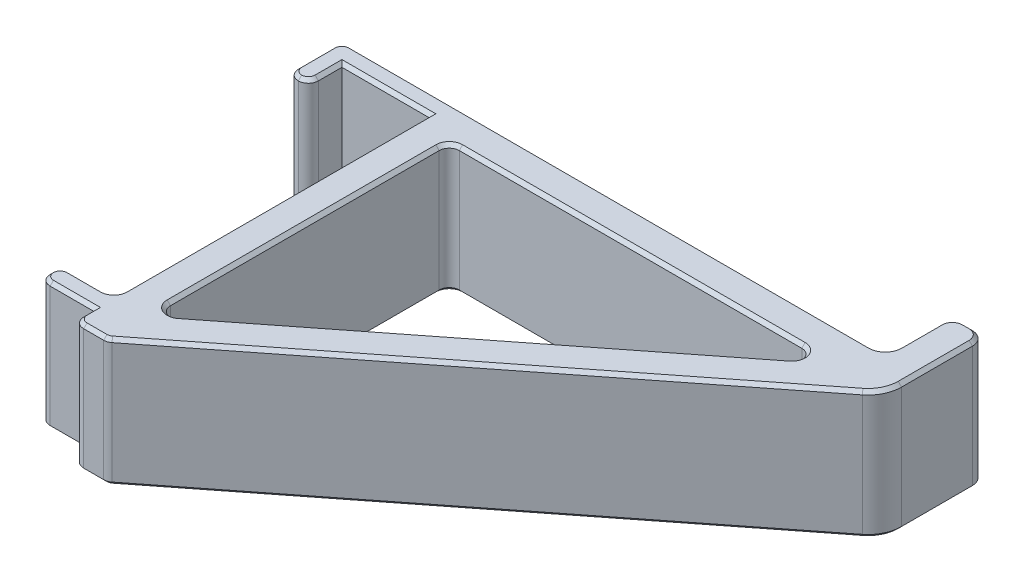
from build123d import *

# Parameters (mm, degrees)
BOSS_EXTRUDE1_DEPTH = 19
FILLET1_R           = 1.5
FILLET2_R           = 2
FILLET3_R           = 5
CHAMFER1_SIZE       = 0.5


with BuildPart() as part:
    # Sketch1 → Boss-Extrude1 (new body)
    with BuildSketch(Plane(origin=(0, 0, 0), x_dir=(1, 0, 0), z_dir=(0, 1, 0))):
        Polygon((-47.925925926, 24.470420803), (-47.925925926, -7.529579197), (-47.925925926, -22.529579197), (-55.925925926, -22.529579197), (-55.925925926, -25.529579197), (-47.925925926, -25.529579197), (-47.925925926, -28.529579197), (-42.925925926, -28.529579197), (22.074074074, 22.470420803), (22.074074074, 24.470420803), (22.074074074, 27.470420803), (22.074074074, 37.470420803), (17.074074074, 37.470420803), (17.074074074, 27.470420803), (-42.925925926, 27.470420803), (-47.925925926, 27.470420803), (-63.925925926, 27.470420803), (-63.925925926, 24.470420803), (-63.925925926, 19.470420803), (-60.925925926, 19.470420803), (-60.925925926, 24.470420803), align=None)
        Polygon((13.974112284, 22.470420803), (-13.512360238, 0.904111593), (-42.925925926, -22.174224561), (-42.925925926, 22.470420803), align=None, mode=Mode.SUBTRACT)
    extrude(amount=BOSS_EXTRUDE1_DEPTH)

    # Fillet1
    fillet1_edges = [part.edges().sort_by_distance(p)[0] for p in [
        (13.974112284, 9.5, -22.470420803),
        (-42.925925926, 9.5, -22.470420803),
        (-42.925925926, 9.5, 22.174224561),
        (-47.925925926, 9.5, 28.529579197),
        (-55.925925926, 9.5, 25.529579197),
        (-55.925925926, 9.5, 22.529579197),
        (-47.925925926, 9.5, 22.529579197),
        (-63.925925926, 9.5, -27.470420803),
        (-63.925925926, 9.5, -19.470420803),
        (-60.925925926, 9.5, -19.470420803),
        (-42.925925926, 9.5, 28.529579197),
    ]]
    fillet(fillet1_edges, radius=FILLET1_R - 0.0001)  # a hair under: the kernel refuses the full size

    # Fillet2
    fillet2_edges = [part.edges().sort_by_distance(p)[0] for p in [
        (17.074074074, 9.5, -37.470420803),
        (22.074074074, 9.5, -37.470420803),
        (17.074074074, 9.5, -27.470420803),
    ]]
    fillet(fillet2_edges, radius=FILLET2_R)

    # Fillet3
    fillet3_edges = [part.edges().sort_by_distance(p)[0] for p in [
        (22.074074074, 9.5, -22.470420803),
    ]]
    fillet(fillet3_edges, radius=FILLET3_R)

    # Chamfer1
    chamfer1_edges = [part.edges().sort_by_distance(p)[0] for p in [
        (19.574074074, 0, -37.470420803),
        (19.574074074, 19, -37.470420803),
        (17.074074074, 0, -32.470420803),
        (17.659860512, 0, -36.884634365),
        (21.488287636, 0, -36.884634365),
        (17.074074074, 19, -32.470420803),
        (17.659860512, 19, -36.884634365),
        (21.488287636, 19, -36.884634365),
        (16.488287636, 0, -28.056207241),
        (16.488287636, 19, -28.056207241),
        (22.074074074, 0, -30.186559659),
        (22.074074074, 19, -30.186559659),
        (-11.178869129, 0, 3.620350018),
        (21.570304248, 0, -22.715482427),
        (-11.178869129, 19, 3.620350018),
        (21.570304248, 19, -22.715482427),
        (-47.925925926, 0, 26.279629197),
        (-54.425925926, 0, -24.470420803),
        (-60.925925926, 0, -22.720370803),
        (-60.925925926, 19, -22.720370803),
        (-54.425925926, 19, -24.470420803),
        (-44.935070567, 0, 28.529579197),
        (-47.925925926, 19, 26.279629197),
        (-51.175975926, 0, 25.529579197),
        (-51.925925926, 0, 22.529579197),
        (-47.925925926, 0, -1.720370803),
        (-63.925925926, 0, -23.470420803),
        (-23.675975926, 0, -27.470420803),
        (-42.925925926, 0, -0.93981007),
        (-14.970820153, 0, 0.240218493),
        (-15.896688718, 0, -22.470420803),
        (-61.365236465, 0, -19.909731342),
        (-63.486615387, 0, -19.909731342),
        (-63.486615387, 0, -27.031110264),
        (-55.486615387, 0, 22.968889736),
        (-55.486615387, 0, 25.090268658),
        (-47.486615387, 0, 28.090268658),
        (-42.954332008, 0, 28.447357731),
        (-44.935070567, 19, 28.529579197),
        (-23.675975926, 19, -27.470420803),
        (-63.925925926, 19, -23.470420803),
        (-47.925925926, 19, -1.720370803),
        (-51.925925926, 19, 22.529579197),
        (-51.175975926, 19, 25.529579197),
        (-42.925925926, 19, -0.93981007),
        (-15.896688718, 19, -22.470420803),
        (-14.970820153, 19, 0.240218493),
        (-61.365236465, 19, -19.909731342),
        (-63.486615387, 19, -19.909731342),
        (-63.486615387, 19, -27.031110264),
        (-55.486615387, 19, 22.968889736),
        (-55.486615387, 19, 25.090268658),
        (-47.486615387, 19, 28.090268658),
        (-42.954332008, 19, 28.447357731),
        (11.050327025, 0, -21.460304004),
        (11.050327025, 19, -21.460304004),
        (-42.486615387, 0, -22.031110264),
        (-42.486615387, 19, -22.031110264),
        (-42.082147008, 0, 20.43967979),
        (-42.082147008, 19, 20.43967979),
        (-48.365236465, 0, 22.090268658),
        (-48.365236465, 19, 22.090268658),
    ]]
    chamfer(chamfer1_edges, length=CHAMFER1_SIZE)


solid = part.part
